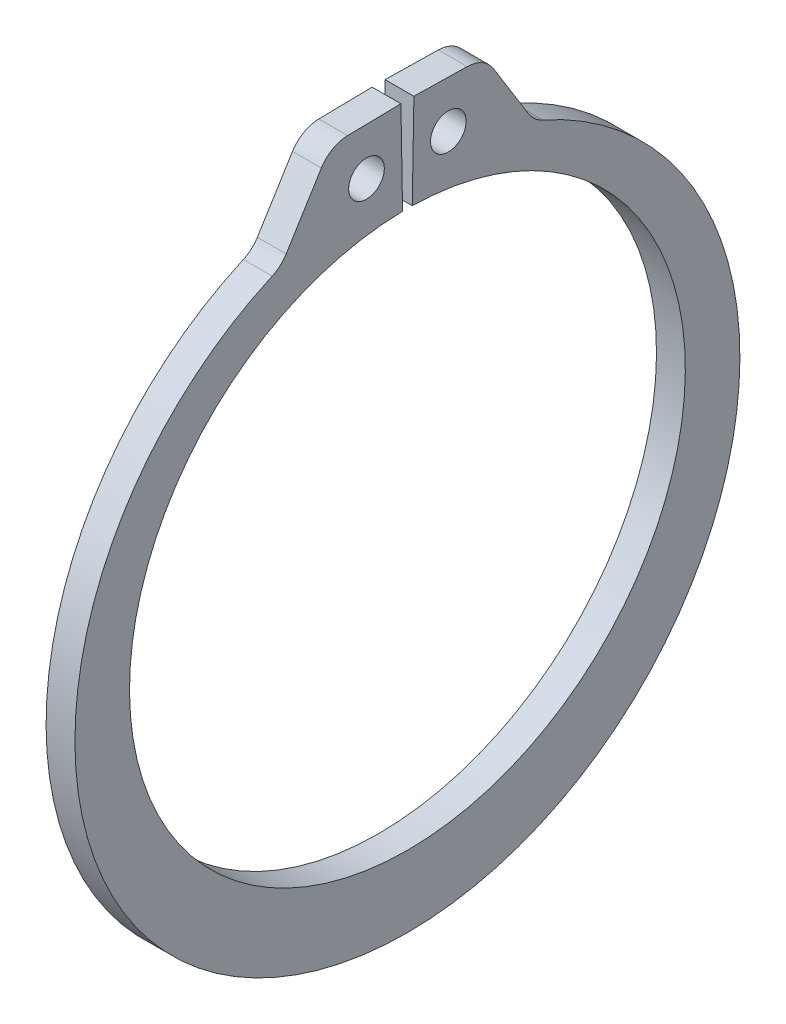
from build123d import *

# Parameters (mm, degrees)
SKETCH1_R      = 0.6604
EXTRUDE1_DEPTH = 0.5334
FILLET1_R      = 1.1684


with BuildPart() as part:
    # Sketch1 → Extrude1 (new, symmetric)
    with BuildSketch(Plane(origin=(0, 0, 0), x_dir=(0, 0, -1), z_dir=(1, 0, 0))):
        with BuildLine():
            Line((-0.179532905, 10.28543324), (-0.240263789, 13.76470325))
            Line((-0.240263789, 13.76470325), (-2.849716296, 13.719155087))
            Line((-2.849716296, 13.719155087), (-4.681521945, 10.760524305))
            ThreePointArc((-4.681521945, 10.760524305), (0, -12.9286), (4.681521945, 10.760524305))
            Line((4.681521945, 10.760524305), (2.849716296, 13.719155087))
            Line((2.849716296, 13.719155087), (0.240263789, 13.76470325))
            Line((0.240263789, 13.76470325), (0.179532905, 10.28543324))
            ThreePointArc((0.179532905, 10.28543324), (0, -10.287), (-0.179532905, 10.28543324))
        make_face()
        with Locations((-1.514624601, 12.002294163)):
            Circle(SKETCH1_R, mode=Mode.SUBTRACT)
        with Locations((1.514624601, 12.002294163)):
            Circle(SKETCH1_R, mode=Mode.SUBTRACT)
    extrude(amount=EXTRUDE1_DEPTH, both=True)

    # Fillet1
    fillet1_edges = [part.edges().sort_by_distance(p)[0] for p in [
        (0, 10.760524305, 4.681521945),
        (0, 10.760524305, -4.681521945),
        (0, 13.719155087, 2.849716296),
        (0, 13.719155087, -2.849716296),
    ]]
    fillet(fillet1_edges, radius=FILLET1_R)


solid = part.part
